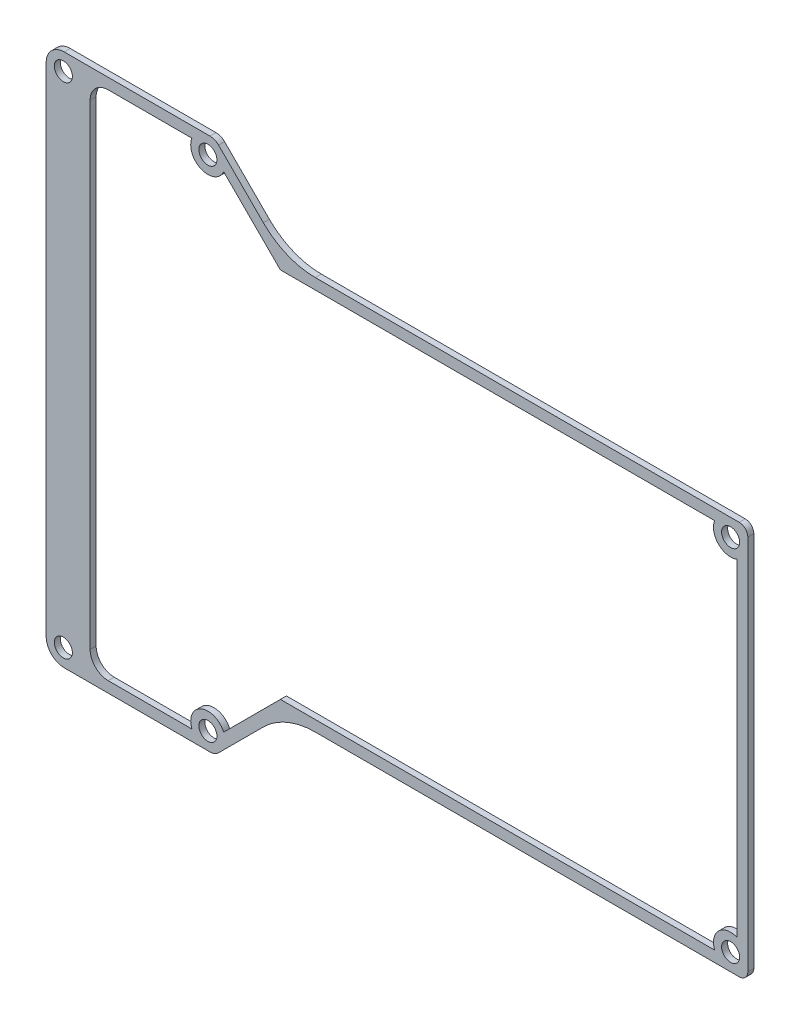
from build123d import *

# Parameters (mm, degrees)
SKETCH2_R           = 1.5
BOSS_EXTRUDE1_DEPTH = 1


with BuildPart() as part:
    # Sketch2 → Boss-Extrude1 (new body)
    with BuildSketch(Plane.XY):
        with BuildLine():
            Line((28.78011557, -21.498473491), (21.333027704, -14.051385626))
            ThreePointArc((21.333027704, -14.051385626), (20.684181007, -13.617840123), (19.918814142, -13.465599188))
            Line((19.918814142, -13.465599188), (-4.3, -13.465599188))
            ThreePointArc((-4.3, -13.465599188), (-6.421320344, -14.344278845), (-7.3, -16.465599188))
            Line((-7.3, -16.465599188), (-7.3, -99.073599188))
            ThreePointArc((-7.3, -99.073599188), (-6.421320344, -101.194919532), (-4.3, -102.073599188))
            Line((-4.3, -102.073599188), (19.918814142, -102.073599188))
            ThreePointArc((19.918814142, -102.073599188), (20.684181007, -101.921358253), (21.333027704, -101.48781275))
            Line((21.333027704, -101.48781275), (28.78511557, -94.035724885))
            ThreePointArc((28.78511557, -94.035724885), (32.741782732, -91.39196441), (37.408989873, -90.463599188))
            Line((37.408989873, -90.463599188), (107.834, -90.463599188))
            ThreePointArc((107.834, -90.463599188), (108.841627163, -90.046226351), (109.259, -89.038599188))
            Line((109.259, -89.038599188), (109.259, -26.495599188))
            ThreePointArc((109.259, -26.495599188), (108.841627163, -25.487972025), (107.834, -25.070599188))
            Line((107.834, -25.070599188), (37.403989873, -25.070599188))
            ThreePointArc((37.403989873, -25.070599188), (32.736782732, -24.142233967), (28.78011557, -21.498473491))
        make_face()
        with Locations((-4.447, -16.318599188)):
            Circle(SKETCH2_R, mode=Mode.SUBTRACT)
        with Locations((106.406, -87.610599188)):
            Circle(SKETCH2_R, mode=Mode.SUBTRACT)
        with Locations((106.406, -27.923599188)):
            Circle(SKETCH2_R, mode=Mode.SUBTRACT)
        with Locations((19.565489973, -16.318599188)):
            Circle(SKETCH2_R, mode=Mode.SUBTRACT)
        with Locations((-4.447, -99.220599188)):
            Circle(SKETCH2_R, mode=Mode.SUBTRACT)
        with Locations((19.565489973, -99.220599188)):
            Circle(SKETCH2_R, mode=Mode.SUBTRACT)
        with BuildLine():
            Line((16.912339393, -100.269599188), (3, -100.269599188))
            ThreePointArc((3, -100.269599188), (0.878679656, -99.390919532), (0, -97.269599188))
            Line((0, -97.269599188), (0, -18.269599188))
            ThreePointArc((0, -18.269599188), (0.878679656, -16.148278845), (3, -15.269599188))
            Line((3, -15.269599188), (16.912339393, -15.269599188))
            ThreePointArc((16.912339393, -15.269599188), (18.473694141, -18.954427494), (22.183305753, -17.452904941))
            Line((22.183305753, -17.452904941), (31.605, -26.874599188))
            Line((31.605, -26.874599188), (103.75284942, -26.874599188))
            ThreePointArc((103.75284942, -26.874599188), (104.388624353, -29.940974835), (107.455, -30.576749768))
            Line((107.455, -30.576749768), (107.455, -84.957448608))
            ThreePointArc((107.455, -84.957448608), (104.388624353, -85.593223541), (103.75284942, -88.659599188))
            Line((103.75284942, -88.659599188), (31.61, -88.659599188))
            Line((31.61, -88.659599188), (22.183305753, -98.086293435))
            ThreePointArc((22.183305753, -98.086293435), (18.473694141, -96.584770882), (16.912339393, -100.269599188))
        make_face(mode=Mode.SUBTRACT)
    extrude(amount=BOSS_EXTRUDE1_DEPTH)


solid = part.part
